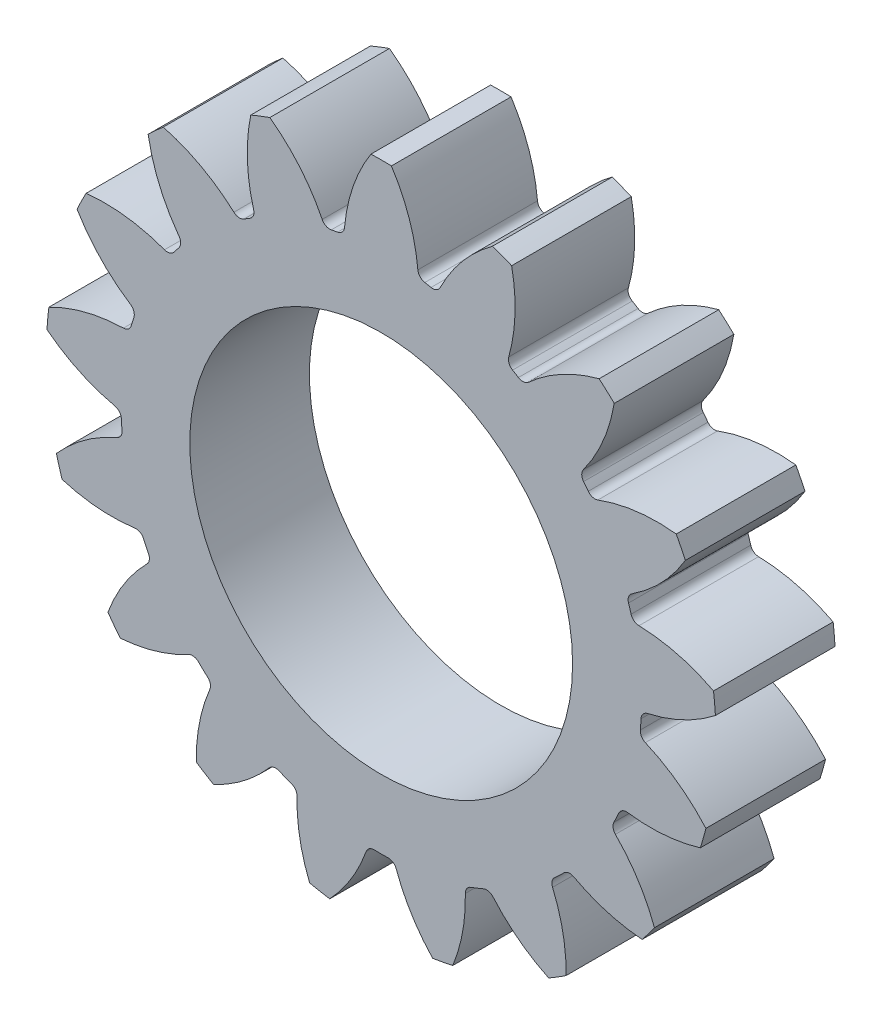
from build123d import *

# Parameters (mm, degrees)
SKETCH_1_R               = 10.875
EXTRUDE_1_DEPTH          = 5
EXTRUDE_2_DEPTH          = 5
FILLET_1_R               = 0.35
PATTERN_CIRCULAR_1_DEPTH = 5
CUT_EXTRUDE_1_REACH      = 22.572
SKETCH_2_R               = 8


# Read off the part's stored shape, not the designer's step: 원형 패턴1
with BuildPart() as part:
    # 스케치1 → 보스-돌출1 (new body)
    with BuildSketch(Plane.XY):
        Circle(SKETCH_1_R)
    extrude(amount=EXTRUDE_1_DEPTH)

    # 스케치1<3> → 보스-돌출2 (add)
    with BuildSketch(Plane.XY):
        with BuildLine():
            ThreePointArc((1.5525, 10.763613183), (1.216970842, 12.576974386), (0.4275, 14.243586057))
            ThreePointArc((0.4275, 14.243586057), (0, 14.25), (-0.4275, 14.243586057))
            ThreePointArc((-0.4275, 14.243586057), (-1.216970842, 12.576974386), (-1.5525, 10.763613183))
            ThreePointArc((-1.5525, 10.763613183), (0, 10.875), (1.5525, 10.763613183))
        make_face()
    extrude(amount=EXTRUDE_2_DEPTH)

    # 필렛1
    fillet_1_edges = [part.edges().sort_by_distance(p)[0] for p in [
        (-1.5525, 10.763613183, 2.5),
        (1.5525, 10.763613183, 2.5),
    ]]
    fillet(fillet_1_edges, radius=FILLET_1_R)

    # 원형 패턴1 outline → 원형 패턴1 (add)
    with BuildSketch(Plane.XY):
        with BuildLine():
            ThreePointArc((2.084837088, 10.673288121), (3.842906104, 10.173381821), (5.492422476, 9.386102511))
            ThreePointArc((5.492422476, 9.386102511), (5.344646109, 9.557145045), (5.332233471, 9.782842475))
            ThreePointArc((5.332233471, 9.782842475), (5.593355494, 11.4564781), (5.452236305, 13.144472855))
            ThreePointArc((5.452236305, 13.144472855), (5.055921411, 13.304884491), (4.654972549, 13.453334479))
            ThreePointArc((4.654972549, 13.453334479), (3.403689946, 12.289385973), (2.465385752, 10.861075951))
            ThreePointArc((2.465385752, 10.861075951), (2.306817266, 10.702930709), (2.084837088, 10.673288121))
        make_face()
        with BuildLine():
            ThreePointArc((5.736195698, 9.2391387), (7.199095251, 8.150990895), (8.459646862, 6.833739823))
            ThreePointArc((8.459646862, 6.833739823), (8.381997736, 7.045900933), (8.450146114, 7.261301773))
            ThreePointArc((8.450146114, 7.261301773), (9.274201483, 8.707038787), (9.740617886, 10.304436202))
            ThreePointArc((9.740617886, 10.304436202), (9.42901262, 10.597181051), (9.108765262, 10.880445977))
            ThreePointArc((9.108765262, 10.880445977), (7.536352291, 10.255192371), (6.155612256, 9.27693802))
            ThreePointArc((6.155612256, 9.27693802), (5.952224819, 9.187903085), (5.736195698, 9.2391387))
        make_face()
        with BuildLine():
            ThreePointArc((8.656847778, 6.582143386), (9.631277253, 5.050160738), (10.337248772, 3.377412148))
            ThreePointArc((10.337248772, 3.377412148), (10.339832595, 3.602419922), (10.478866532, 3.779351375))
            ThreePointArc((10.478866532, 3.779351375), (11.729603042, 4.815098477), (12.713475046, 6.107038785))
            ThreePointArc((12.713475046, 6.107038785), (12.528663426, 6.492580033), (12.332368752, 6.872403399))
            ThreePointArc((12.332368752, 6.872403399), (10.671238348, 6.86130469), (9.057778331, 6.466052652))
            ThreePointArc((9.057778331, 6.466052652), (8.838113972, 6.457792134), (8.656847778, 6.582143386))
        make_face()
        with BuildLine():
            ThreePointArc((10.44566348, 3.025514743), (10.802249116, 1.255802147), (10.861158072, -0.548516485))
            ThreePointArc((10.861158072, -0.548516485), (10.943077602, -0.34062274), (11.134084318, -0.224661311))
            ThreePointArc((11.134084318, -0.224661311), (12.626546762, 0.289328326), (13.969306954, 1.119162384))
            ThreePointArc((13.969306954, 1.119162384), (13.936248813, 1.545430549), (13.890417506, 1.970515105))
            ThreePointArc((13.890417506, 1.970515105), (12.377771936, 2.549980076), (10.773358461, 2.772990553))
            ThreePointArc((10.773358461, 2.772990553), (10.568207288, 2.845653785), (10.44566348, 3.025514743))
        make_face()
        with BuildLine():
            ThreePointArc((10.831434222, -0.972449329), (10.524388312, -2.739137757), (9.931200049, -4.431353133))
            ThreePointArc((9.931200049, -4.431353133), (10.080749628, -4.26807205), (10.298365111, -4.227215102))
            ThreePointArc((10.298365111, -4.227215102), (11.831510548, -4.270865326), (13.338506551, -3.985552654))
            ThreePointArc((13.338506551, -3.985552654), (13.461666574, -3.57612745), (13.572488407, -3.163191729))
            ThreePointArc((13.572488407, -3.163191729), (12.409057254, -2.103647039), (11.041512467, -1.325168872))
            ThreePointArc((11.041512467, -1.325168872), (10.879326869, -1.182845296), (10.831434222, -0.972449329))
        make_face()
        with BuildLine():
            ThreePointArc((9.724818044, -4.867600951), (8.799895988, -6.389636578), (7.638946645, -7.74029193))
            ThreePointArc((7.638946645, -7.74029193), (7.835322049, -7.642919348), (8.051101932, -7.68143897))
            ThreePointArc((8.051101932, -7.68143897), (9.434573038, -8.250170344), (10.906266927, -8.517686277))
            ThreePointArc((10.906266927, -8.517686277), (11.169011671, -8.180399177), (11.421519541, -7.835381548))
            ThreePointArc((11.421519541, -7.835381548), (10.743744256, -6.465085659), (9.78938361, -5.27081353))
            ThreePointArc((9.78938361, -5.27081353), (9.692203368, -5.079599132), (9.724818044, -4.867600951))
        make_face()
        with BuildLine():
            ThreePointArc((7.250855805, -8.104980882), (5.839114845, -9.174440736), (4.272503154, -10.000567074))
            ThreePointArc((4.272503154, -10.000567074), (4.488726043, -9.981391229), (4.674670149, -10.09339498))
            ThreePointArc((4.674670149, -10.09339498), (5.746046713, -11.099844355), (7.00107552, -11.865148727))
            ThreePointArc((7.00107552, -11.865148727), (7.367919852, -11.645552222), (7.728011172, -11.415049228))
            ThreePointArc((7.728011172, -11.415049228), (7.598229184, -9.929070664), (7.162058655, -8.502630716))
            ThreePointArc((7.162058655, -8.502630716), (7.142629708, -8.289552802), (7.250855805, -8.104980882))
        make_face()
        with BuildLine():
            ThreePointArc((3.745858716, -10.209513577), (2.04453627, -10.681081239), (0.289330355, -10.871150489))
            ThreePointArc((0.289330355, -10.871150489), (0.495925275, -10.93192564), (0.627834307, -11.102146342))
            ThreePointArc((0.627834307, -11.102146342), (1.261761796, -12.417365945), (2.150350071, -13.57584665))
            ThreePointArc((2.150350071, -13.57584665), (2.57174963, -13.503598465), (2.990792071, -13.418740812))
            ThreePointArc((2.990792071, -13.418740812), (3.40225572, -12.010026536), (3.516526006, -10.546906395))
            ThreePointArc((3.516526006, -10.546906395), (3.576953157, -10.341342504), (3.745858716, -10.209513577))
        make_face()
        with BuildLine():
            ThreePointArc((-0.289330355, -10.871150489), (-2.04453627, -10.681081239), (-3.745858716, -10.209513577))
            ThreePointArc((-3.745858716, -10.209513577), (-3.576953157, -10.341342504), (-3.516526006, -10.546906395))
            ThreePointArc((-3.516526006, -10.546906395), (-3.40225572, -12.010026536), (-2.990792071, -13.418740812))
            ThreePointArc((-2.990792071, -13.418740812), (-2.57174963, -13.503598465), (-2.150350071, -13.57584665))
            ThreePointArc((-2.150350071, -13.57584665), (-1.261761796, -12.417365945), (-0.627834307, -11.102146342))
            ThreePointArc((-0.627834307, -11.102146342), (-0.495925275, -10.93192564), (-0.289330355, -10.871150489))
        make_face()
        with BuildLine():
            ThreePointArc((-4.272503154, -10.000567074), (-5.839114845, -9.174440736), (-7.250855805, -8.104980882))
            ThreePointArc((-7.250855805, -8.104980882), (-7.142629708, -8.289552802), (-7.162058655, -8.502630716))
            ThreePointArc((-7.162058655, -8.502630716), (-7.598229184, -9.929070664), (-7.728011172, -11.415049228))
            ThreePointArc((-7.728011172, -11.415049228), (-7.367919852, -11.645552222), (-7.00107552, -11.865148727))
            ThreePointArc((-7.00107552, -11.865148727), (-5.746046713, -11.099844355), (-4.674670149, -10.09339498))
            ThreePointArc((-4.674670149, -10.09339498), (-4.488726043, -9.981391229), (-4.272503154, -10.000567074))
        make_face()
        with BuildLine():
            ThreePointArc((-7.638946645, -7.74029193), (-8.799895988, -6.389636578), (-9.724818044, -4.867600951))
            ThreePointArc((-9.724818044, -4.867600951), (-9.692203368, -5.079599132), (-9.78938361, -5.27081353))
            ThreePointArc((-9.78938361, -5.27081353), (-10.743744256, -6.465085659), (-11.421519541, -7.835381548))
            ThreePointArc((-11.421519541, -7.835381548), (-11.169011671, -8.180399177), (-10.906266927, -8.517686277))
            ThreePointArc((-10.906266927, -8.517686277), (-9.434573038, -8.250170344), (-8.051101932, -7.68143897))
            ThreePointArc((-8.051101932, -7.68143897), (-7.835322049, -7.642919348), (-7.638946645, -7.74029193))
        make_face()
        with BuildLine():
            ThreePointArc((-9.931200049, -4.431353133), (-10.524388312, -2.739137757), (-10.831434222, -0.972449329))
            ThreePointArc((-10.831434222, -0.972449329), (-10.879326869, -1.182845296), (-11.041512467, -1.325168872))
            ThreePointArc((-11.041512467, -1.325168872), (-12.409057254, -2.103647039), (-13.572488407, -3.163191729))
            ThreePointArc((-13.572488407, -3.163191729), (-13.461666574, -3.57612745), (-13.338506551, -3.985552654))
            ThreePointArc((-13.338506551, -3.985552654), (-11.831510548, -4.270865326), (-10.298365111, -4.227215102))
            ThreePointArc((-10.298365111, -4.227215102), (-10.080749628, -4.26807205), (-9.931200049, -4.431353133))
        make_face()
        with BuildLine():
            ThreePointArc((-10.861158072, -0.548516485), (-10.802249116, 1.255802147), (-10.44566348, 3.025514743))
            ThreePointArc((-10.44566348, 3.025514743), (-10.568207288, 2.845653785), (-10.773358461, 2.772990553))
            ThreePointArc((-10.773358461, 2.772990553), (-12.377771936, 2.549980076), (-13.890417506, 1.970515105))
            ThreePointArc((-13.890417506, 1.970515105), (-13.936248813, 1.545430549), (-13.969306954, 1.119162384))
            ThreePointArc((-13.969306954, 1.119162384), (-12.626546762, 0.289328326), (-11.134084318, -0.224661311))
            ThreePointArc((-11.134084318, -0.224661311), (-10.943077602, -0.34062274), (-10.861158072, -0.548516485))
        make_face()
        with BuildLine():
            ThreePointArc((-10.337248772, 3.377412148), (-9.631277253, 5.050160738), (-8.656847778, 6.582143386))
            ThreePointArc((-8.656847778, 6.582143386), (-8.838113972, 6.457792134), (-9.057778331, 6.466052652))
            ThreePointArc((-9.057778331, 6.466052652), (-10.671238348, 6.86130469), (-12.332368752, 6.872403399))
            ThreePointArc((-12.332368752, 6.872403399), (-12.528663426, 6.492580033), (-12.713475046, 6.107038785))
            ThreePointArc((-12.713475046, 6.107038785), (-11.729603042, 4.815098477), (-10.478866532, 3.779351375))
            ThreePointArc((-10.478866532, 3.779351375), (-10.339832595, 3.602419922), (-10.337248772, 3.377412148))
        make_face()
        with BuildLine():
            ThreePointArc((-8.459646862, 6.833739823), (-7.199095251, 8.150990895), (-5.736195698, 9.2391387))
            ThreePointArc((-5.736195698, 9.2391387), (-5.952224819, 9.187903085), (-6.155612256, 9.27693802))
            ThreePointArc((-6.155612256, 9.27693802), (-7.536352291, 10.255192371), (-9.108765262, 10.880445977))
            ThreePointArc((-9.108765262, 10.880445977), (-9.42901262, 10.597181051), (-9.740617886, 10.304436202))
            ThreePointArc((-9.740617886, 10.304436202), (-9.274201483, 8.707038787), (-8.450146114, 7.261301773))
            ThreePointArc((-8.450146114, 7.261301773), (-8.381997736, 7.045900933), (-8.459646862, 6.833739823))
        make_face()
        with BuildLine():
            ThreePointArc((-2.465385752, 10.861075951), (-3.403689946, 12.289385973), (-4.654972549, 13.453334479))
            ThreePointArc((-4.654972549, 13.453334479), (-5.055921411, 13.304884491), (-5.452236305, 13.144472855))
            ThreePointArc((-5.452236305, 13.144472855), (-5.593355494, 11.4564781), (-5.332233471, 9.782842475))
            ThreePointArc((-5.332233471, 9.782842475), (-5.344646109, 9.557145045), (-5.492422476, 9.386102511))
            ThreePointArc((-5.492422476, 9.386102511), (-3.842906104, 10.173381821), (-2.084837088, 10.673288121))
            ThreePointArc((-2.084837088, 10.673288121), (-2.306817266, 10.702930709), (-2.465385752, 10.861075951))
        make_face()
    extrude(amount=PATTERN_CIRCULAR_1_DEPTH)

    # 스케치2 → 컷-돌출1 (cut, up to next)
    with BuildSketch(Plane.XY.offset(5), mode=Mode.PRIVATE) as cut_extrude_1_sk1:
        Circle(SKETCH_2_R)
    cut_extrude_1_tool1 = extrude(cut_extrude_1_sk1.sketch, amount=-CUT_EXTRUDE_1_REACH, mode=Mode.PRIVATE) & part.part
    add(cut_extrude_1_tool1.solids().sort_by_distance((0, 0, 5))[0], mode=Mode.SUBTRACT)


solid = part.part
